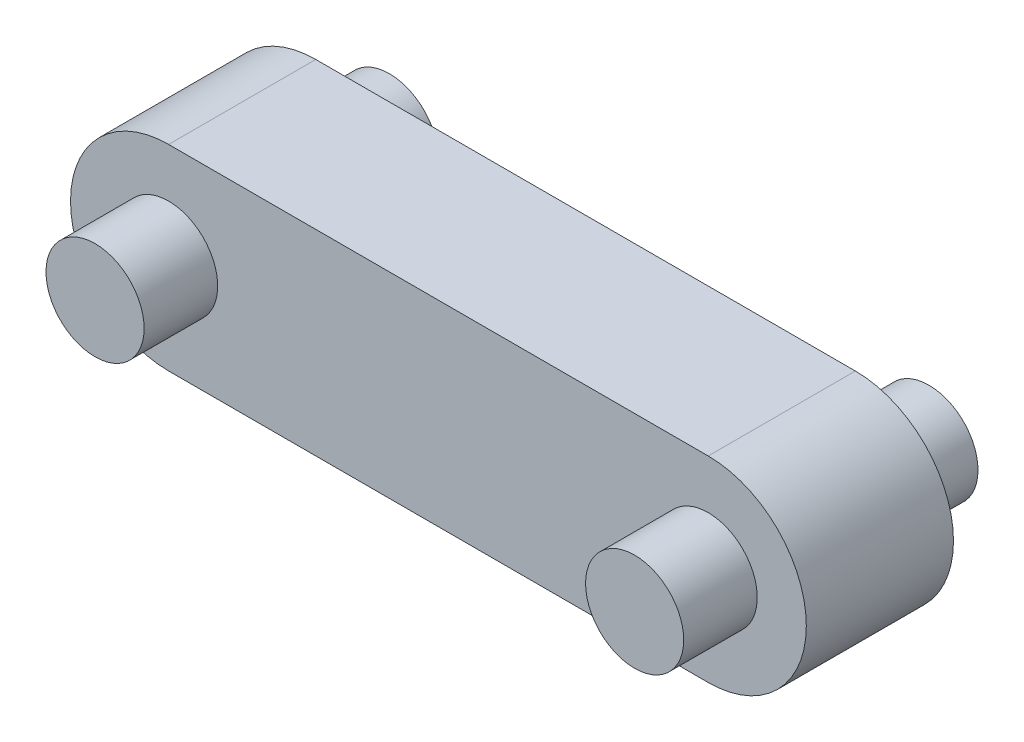
from build123d import *

# Parameters (mm, degrees)
SKETCH1_R           = 10
BOSS_EXTRUDE1_DEPTH = 30
BOSS_EXTRUDE2_DEPTH = 15
MIRROR2_START       = -15
MIRROR2_DEPTH       = 30
SKETCH4_R           = 10
BOSS_EXTRUDE3_DEPTH = 30


# Read off the part's stored shape, not the designer's step: Mirror2
with BuildPart() as part:
    # Sketch1 → Boss-Extrude1 (new, symmetric)
    with BuildSketch(Plane.XY):
        Circle(SKETCH1_R)
    extrude(amount=BOSS_EXTRUDE1_DEPTH, both=True)

    # Sketch2 → Boss-Extrude2 (add, symmetric)
    with BuildSketch(Plane.XY):
        with BuildLine():
            Line((0, 20), (55, 20))
            Line((55, 20), (55, -20))
            Line((55, -20), (0, -20))
            ThreePointArc((0, -20), (-20, 0), (0, 20))
        make_face()
    extrude(amount=BOSS_EXTRUDE2_DEPTH, both=True)

    # Mirror2 outline → Mirror2 (add)
    with BuildSketch(Plane.XY.offset(MIRROR2_START)):
        with BuildLine():
            Line((55, -20), (110, -20))
            ThreePointArc((110, -20), (130, 0), (110, 20))
            Line((110, 20), (55, 20))
            Line((55, 20), (55, -20))
        make_face()
    extrude(amount=MIRROR2_DEPTH)

    # Sketch4 → Boss-Extrude3 (add, symmetric)
    with BuildSketch(Plane.XY):
        with Locations(Location((110, 0, 0), (0, 0, 180))):
            Circle(SKETCH4_R)
    extrude(amount=BOSS_EXTRUDE3_DEPTH, both=True)


solid = part.part
